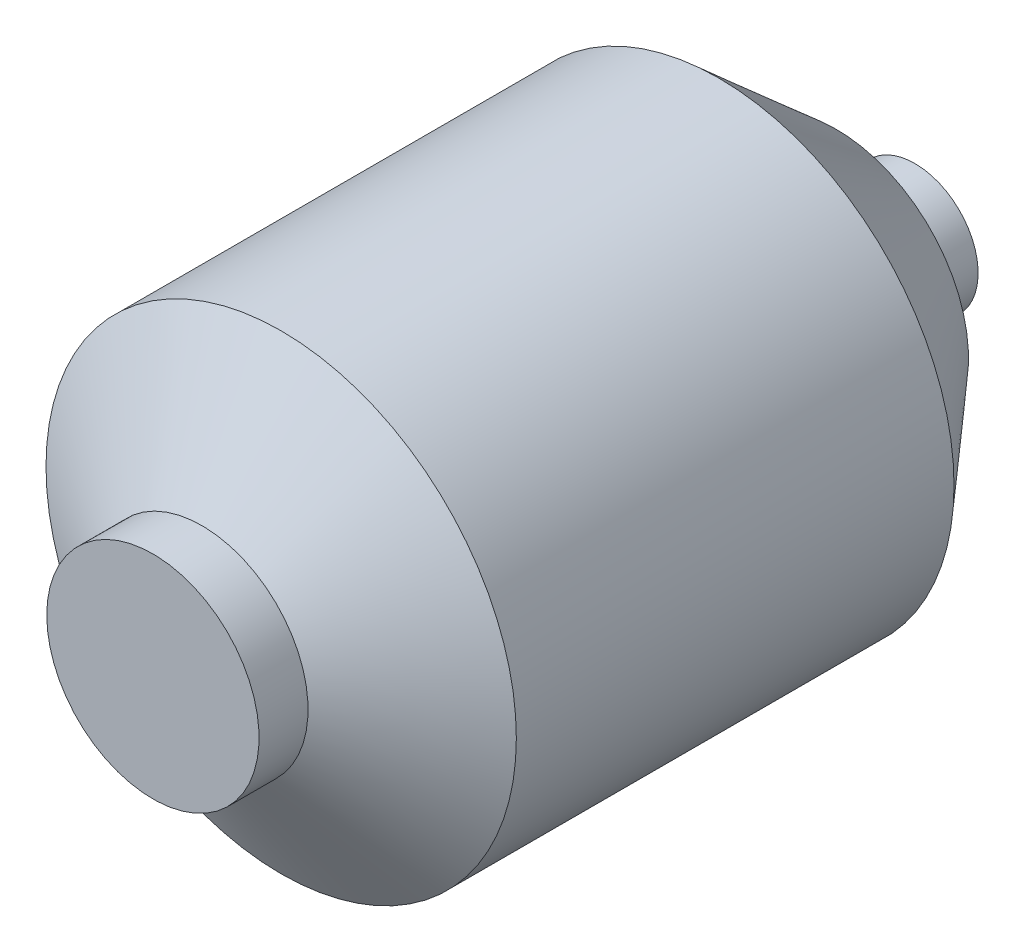
from build123d import *


with BuildPart() as part:
    # Sketch1 → Revolve1 (revolve)
    with BuildSketch(Plane(origin=(0, 0, 0), x_dir=(1, 0, 0), z_dir=(0, 1, 0))):
        Polygon((-40.481929622, 44.050922019), (-72, 8.116883117), (-72, -125.883116883), (-32.5, -150.153116883), (-32.5, -165.153116883), (0, -165.153116883), (0, -150.153116883), (0, 68.116883117), (-19.373457578, 68.116883117), (-19.373457578, 46.846883117), align=None)
    revolve(axis=Axis((0, 0, -73.083687066), (0, 0, 1)))


solid = part.part
